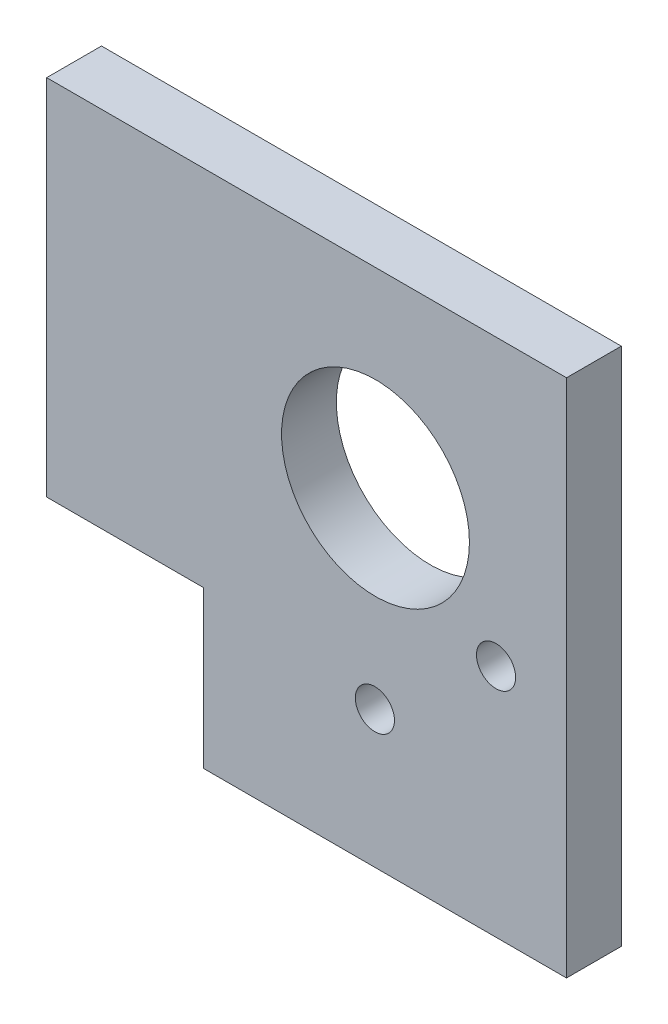
from build123d import *

# Parameters (mm, degrees)
BOSS_EXTRUDE1_DEPTH = 7
SKETCH2_R           = 12
CUT_EXTRUDE1_DEPTH  = 60.808026217
SKETCH3_R           = 2.5
CUT_EXTRUDE2_DEPTH  = 60.808026217


with BuildPart() as part:
    # Sketch1 → Boss-Extrude1 (new body)
    with BuildSketch(Plane.XY):
        Polygon((0, 24.4), (24.4, 24.4), (24.4, -42), (-22, -42), (-22, -22), (-42, -22), (-42, 24.4), align=None)
    extrude(amount=BOSS_EXTRUDE1_DEPTH)

    # Sketch2 → Cut-Extrude1 (cut, through all)
    with BuildSketch(Plane.XY.offset(7)):
        Circle(SKETCH2_R)
    extrude(amount=-CUT_EXTRUDE1_DEPTH, mode=Mode.SUBTRACT)

    # Sketch3 → Cut-Extrude2 (cut, through all)
    with BuildSketch(Plane.XY.offset(7)):
        with Locations((-0.075999693, -24.5)):
            Circle(SKETCH3_R)
        with Locations((15.4, -12)):
            Circle(SKETCH3_R)
    extrude(amount=-CUT_EXTRUDE2_DEPTH, mode=Mode.SUBTRACT)


solid = part.part
